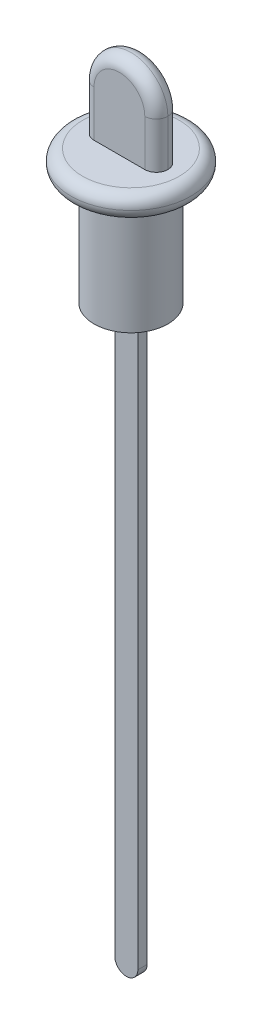
from build123d import *

# Parameters (mm, degrees)
SKETCH1_R           = 5.08
BOSS_EXTRUDE1_DEPTH = 15.24
SKETCH2_R           = 8.255
BOSS_EXTRUDE2_DEPTH = 3.175
BOSS_EXTRUDE3_DEPTH = 1.5875
FILLET1_R           = 1.5875
SKETCH4_W           = 3.175
SKETCH4_H           = 1.27
BOSS_EXTRUDE4_DEPTH = 80.01
FILLET3_R           = 1.5875


with BuildPart() as part:
    # Sketch1 → Boss-Extrude1 (new body)
    with BuildSketch(Plane(origin=(0, 0, 0), x_dir=(1, 0, 0), z_dir=(0, 1, 0))):
        with Locations(Location((0, 0, 0), (0, 0, 270))):
            Circle(SKETCH1_R)
    extrude(amount=-BOSS_EXTRUDE1_DEPTH)

    # Sketch2 → Boss-Extrude2 (add)
    with BuildSketch(Plane(origin=(0, 0, 0), x_dir=(1, 0, 0), z_dir=(0, 1, 0))):
        with Locations(Location((0, 0, 0), (0, 0, 270))):
            Circle(SKETCH2_R)
    extrude(amount=BOSS_EXTRUDE2_DEPTH)

    # Sketch3 → Boss-Extrude3 (add, symmetric)
    with BuildSketch(Plane.XY):
        with BuildLine():
            Line((5.08, 3.175), (-5.08, 3.175))
            Line((-5.08, 3.175), (-5.08, 9.525))
            ThreePointArc((-5.08, 9.525), (0, 14.605), (5.08, 9.525))
            Line((5.08, 9.525), (5.08, 3.175))
        make_face()
    extrude(amount=BOSS_EXTRUDE3_DEPTH, both=True)

    # Fillet1
    fillet1_edges = [part.edges().sort_by_distance(p)[0] for p in [
        (5.08, 6.35, -1.5875),
        (-5.08, 6.35, -1.5875),
        (-5.08, 6.35, 1.5875),
        (0, 14.605, 1.5875),
        (0, 0, -8.255),
        (0, 3.175, -8.255),
        (0, 14.605, -1.5875),
        (5.08, 6.35, 1.5875),
    ]]
    fillet(fillet1_edges, radius=FILLET1_R - 0.0001)  # a hair under: the kernel refuses the full size

    # Sketch4 → Boss-Extrude4 (add)
    with BuildSketch(Plane.XZ.offset(15.24)):
        Rectangle(SKETCH4_W, SKETCH4_H)
    extrude(amount=BOSS_EXTRUDE4_DEPTH)

    # Fillet3
    fillet3_edges = [part.edges().sort_by_distance(p)[0] for p in [
        (-1.5875, -95.25, 0),
        (1.5875, -95.25, 0),
    ]]
    fillet(fillet3_edges, radius=FILLET3_R - 0.0001)  # a hair under: the kernel refuses the full size


solid = part.part
